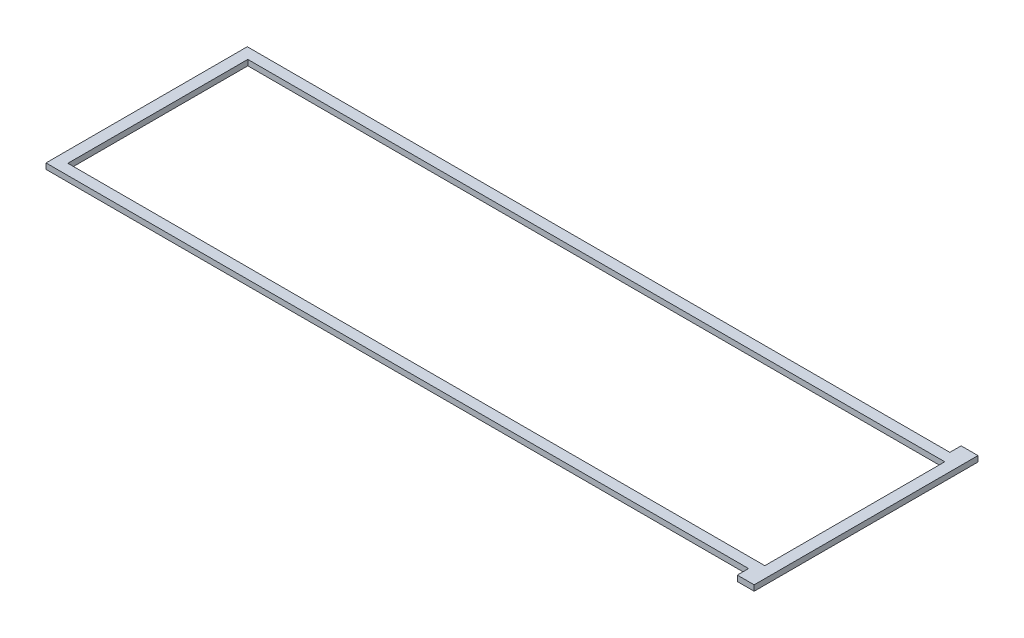
from build123d import *

# Parameters (mm, degrees)
SKETCH1_W           = 393.7
SKETCH1_H           = 101.6508
BOSS_EXTRUDE1_DEPTH = 3.175


with BuildPart() as part:
    # Sketch1 → Boss-Extrude1 (new body)
    with BuildSketch(Plane(origin=(0, 0, 0), x_dir=(1, 0, 0), z_dir=(0, 1, 0))):
        Polygon((193.675, -56.848375), (193.675, -63.223775), (203.2, -63.223775), (203.2, 63.223775), (193.675, 63.223775), (193.675, 56.848375), (-203.2, 56.848375), (-203.2, -56.848375), align=None)
        with Locations((0, -0.0254)):
            Rectangle(SKETCH1_W, SKETCH1_H, mode=Mode.SUBTRACT)
    extrude(amount=BOSS_EXTRUDE1_DEPTH)


solid = part.part
